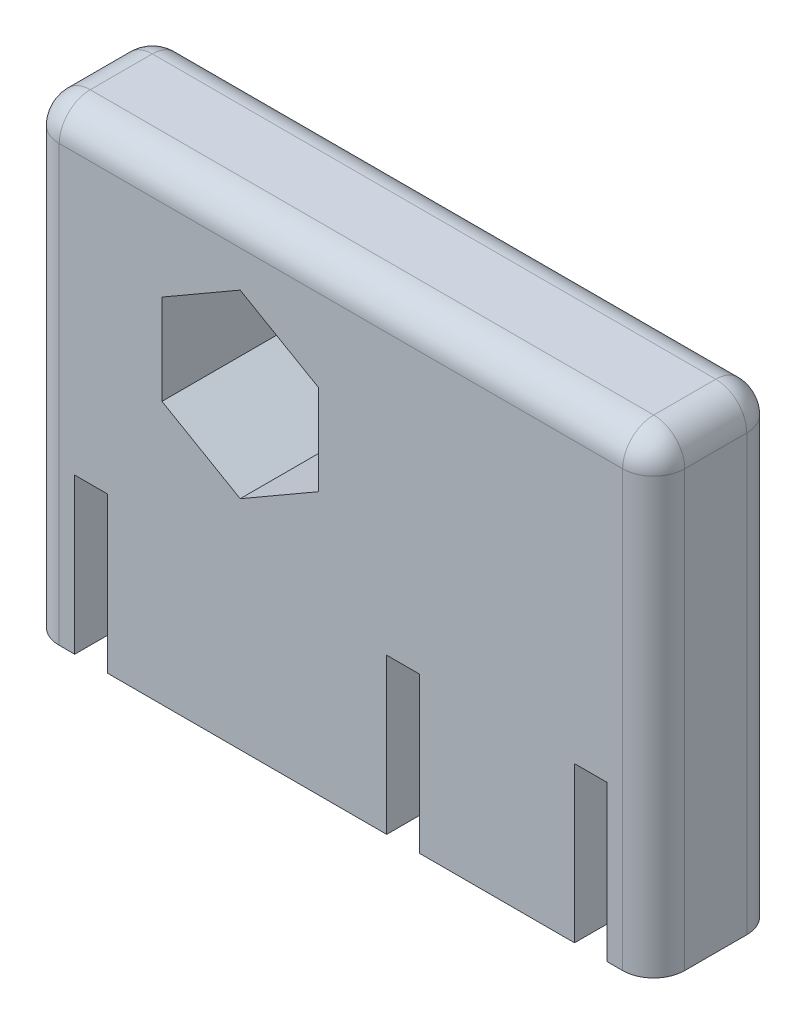
from build123d import *

# Parameters (mm, degrees)
BOSS_EXTRUDE1_DEPTH = 8
FILLET6_R           = 2
FILLET7_R           = 2
FILLET8_R           = 2


with BuildPart() as part:
    # Sketch1 → Boss-Extrude1 (new body)
    with BuildSketch(Plane.XY):
        Polygon((-17.15, -15), (-17.15, -5), (-15.05, -5), (-15.05, -15), (2.95, -15), (2.95, -5), (5.05, -5), (5.05, -15), (15.05, -15), (15.05, -5), (17.15, -5), (17.15, -15), (20.15, -15), (20.15, 15), (-20.15, 15), (-20.15, -15), align=None)
        Polygon((-1.4497978, 7.740960344), (-6.4897978, 10.650805701), (-11.5297978, 7.740960344), (-11.5297978, 1.921269631), (-6.4897978, -0.988575726), (-1.4497978, 1.921269631), align=None, mode=Mode.SUBTRACT)
    extrude(amount=BOSS_EXTRUDE1_DEPTH)

    # Fillet6
    fillet6_edges = [part.edges().sort_by_distance(p)[0] for p in [
        (-20.15, 15, 4),
    ]]
    fillet(fillet6_edges, radius=FILLET6_R)

    # Fillet7
    fillet7_edges = [part.edges().sort_by_distance(p)[0] for p in [
        (20.15, 0, 0),
        (20.15, 15, 4),
        (20.15, 0, 8),
    ]]
    fillet(fillet7_edges, radius=FILLET7_R)

    # Fillet8
    # the kernel refuses this fillet: 2 mm, written as the material it takes off along each edge
    with BuildSketch(Plane(origin=(18.15, 13, 2), x_dir=(0, 0, -1), z_dir=(0, 1, 0))) as fillet8_piece_1_section:
        Polygon((0, 0), (FILLET8_R, 0), (FILLET8_R, -FILLET8_R), (0, -FILLET8_R), align=None)
    fillet8_piece_1 = extrude(amount=FILLET8_R, mode=Mode.PRIVATE)
    fillet8_piece_1 = fillet8_piece_1 - Plane(origin=(18.15, 13, 2), x_dir=(-0.7071067811865475, 0, 0.7071067811865475), z_dir=(0, 1, 0)) * Sphere(FILLET8_R, mode=Mode.PRIVATE)
    add(fillet8_piece_1, mode=Mode.SUBTRACT)
    with BuildSketch(Plane(origin=(18.15, 13, 6), x_dir=(0, 0, 1), z_dir=(0, 1, 0))) as fillet8_piece_2_section:
        Polygon((0, 0), (FILLET8_R, 0), (FILLET8_R, FILLET8_R), (0, FILLET8_R), align=None)
    fillet8_piece_2 = extrude(amount=FILLET8_R, mode=Mode.PRIVATE)
    fillet8_piece_2 = fillet8_piece_2 - Plane(origin=(18.15, 13, 6), x_dir=(-0.7071067811865475, 0, -0.7071067811865475), z_dir=(0, 1, 0)) * Sphere(FILLET8_R, mode=Mode.PRIVATE)
    add(fillet8_piece_2, mode=Mode.SUBTRACT)
    with BuildSketch(Plane(origin=(-20.15, 13, 0), x_dir=(1, 0, 0), z_dir=(0, -1, 0))) as fillet8_piece_3:
        with BuildLine():
            CenterArc((FILLET8_R, FILLET8_R), FILLET8_R, 180, 90)
            Line((0, FILLET8_R), (0, 0))
            Line((0, 0), (FILLET8_R, 0))
        make_face()
    extrude(amount=33, mode=Mode.SUBTRACT)
    with BuildSketch(Plane(origin=(-20.15, 13, 8), x_dir=(1, 0, 0), z_dir=(0, -1, 0))) as fillet8_piece_4:
        with BuildLine():
            CenterArc((FILLET8_R, -FILLET8_R), FILLET8_R, 90, 90)
            Line((0, -FILLET8_R), (0, 0))
            Line((0, 0), (FILLET8_R, 0))
        make_face()
    extrude(amount=33, mode=Mode.SUBTRACT)
    with BuildSketch(Plane(origin=(-18.15, 13, 0), x_dir=(0, 1, 0), z_dir=(1, 0, 0))) as fillet8_piece_5:
        with BuildLine():
            CenterArc((2 - FILLET8_R, FILLET8_R), FILLET8_R, 270, 90)
            Line((2, FILLET8_R), (2, 0))
            Line((2, 0), (2 - FILLET8_R, 0))
        make_face()
    revolve(axis=Axis((-18.15, 13, 0), (0, 0, 1)), revolution_arc=90, mode=Mode.SUBTRACT)
    with BuildSketch(Plane(origin=(-18.15, 13, 8), x_dir=(0, 1, 0), z_dir=(1, 0, 0))) as fillet8_piece_6:
        with BuildLine():
            CenterArc((2 - FILLET8_R, -FILLET8_R), FILLET8_R, 0, 90)
            Line((2 - FILLET8_R, 0), (2, 0))
            Line((2, 0), (2, -FILLET8_R))
        make_face()
    revolve(axis=Axis((-18.15, 13, 8), (0, 0, 1)), revolution_arc=90, mode=Mode.SUBTRACT)
    with BuildSketch(Plane(origin=(18.15, 15, 8), x_dir=(0, 0, -1), z_dir=(-1, 0, 0))) as fillet8_piece_7:
        with BuildLine():
            CenterArc((FILLET8_R, FILLET8_R), FILLET8_R, 180, 90)
            Line((0, FILLET8_R), (0, 0))
            Line((0, 0), (FILLET8_R, 0))
        make_face()
    extrude(amount=36.3, mode=Mode.SUBTRACT)
    with BuildSketch(Plane(origin=(18.15, 15, 0), x_dir=(0, 0, 1), z_dir=(-1, 0, 0))) as fillet8_piece_8:
        with BuildLine():
            CenterArc((FILLET8_R, -FILLET8_R), FILLET8_R, 90, 90)
            Line((0, -FILLET8_R), (0, 0))
            Line((0, 0), (FILLET8_R, 0))
        make_face()
    extrude(amount=36.3, mode=Mode.SUBTRACT)


solid = part.part
